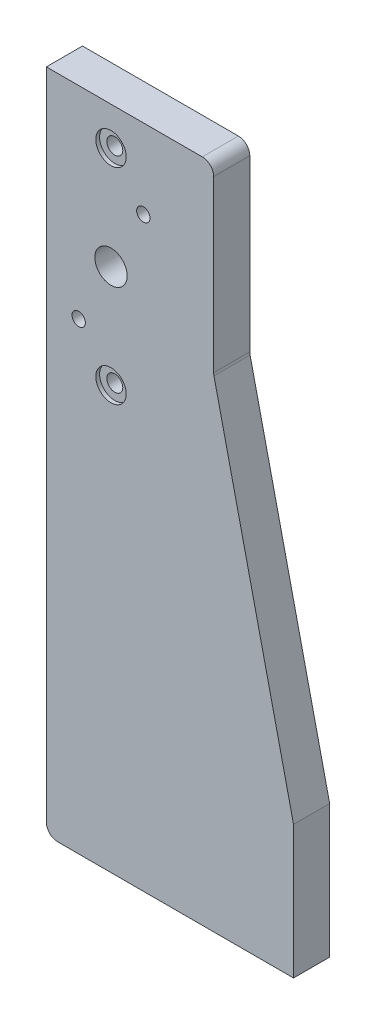
from build123d import *

# Parameters (mm, degrees)
EXTRUDE_1_DEPTH     = 9.5
SKETCH_6_R          = 2.1
CUT_EXTRUDE_5_DEPTH = 187.923112536
SKETCH_7_R          = 4
CUT_EXTRUDE_6_DEPTH = 1
FILLET_1_R          = 3
SKETCH_8_R          = 4.25
CUT_EXTRUDE_7_DEPTH = 10
SKETCH_9_R          = 1.75
CUT_EXTRUDE_8_DEPTH = 187.923112536


with BuildPart() as part:
    # 草图5 → 凸台-拉伸1 (new body)
    with BuildSketch(Plane.XY):
        Polygon((0, 0), (0, 175), (44, 175), (44, 127), (65, 35), (65, 0), align=None)
    extrude(amount=EXTRUDE_1_DEPTH)

    # 草图6 → 切除-拉伸5 (cut, through all)
    with BuildSketch(Plane.XY.offset(9.5)):
        with Locations((17, 165)):
            Circle(SKETCH_6_R)
        with Locations((17, 111)):
            Circle(SKETCH_6_R)
    extrude(amount=-CUT_EXTRUDE_5_DEPTH, mode=Mode.SUBTRACT)

    # 草图7 → 切除-拉伸6 (cut)
    with BuildSketch(Plane.XY.offset(9.5)):
        with Locations((17, 165)):
            Circle(SKETCH_7_R)
        with Locations((17, 111)):
            Circle(SKETCH_7_R)
    extrude(amount=-CUT_EXTRUDE_6_DEPTH, mode=Mode.SUBTRACT)

    # 圆角1
    fillet_1_edges = [part.edges().sort_by_distance(p)[0] for p in [
        (0, 0, 4.75),
        (44, 127, 4.75),
        (44, 175, 4.75),
    ]]
    fillet(fillet_1_edges, radius=FILLET_1_R)

    # 草图8 → 切除-拉伸7 (cut)
    with BuildSketch(Plane.XY.offset(9.5)):
        with Locations((17, 138)):
            Circle(SKETCH_8_R)
    extrude(amount=-CUT_EXTRUDE_7_DEPTH, mode=Mode.SUBTRACT)

    # 草图9 → 切除-拉伸8 (cut, through all)
    with BuildSketch(Plane(origin=(0, 0, 0), x_dir=(-1, 0, 0), z_dir=(0, 0, -1))):
        with Locations((-25.5, 154.1496904)):
            Circle(SKETCH_9_R)
        with Locations((-8.5, 121.8503096)):
            Circle(SKETCH_9_R)
    extrude(amount=-CUT_EXTRUDE_8_DEPTH, mode=Mode.SUBTRACT)


solid = part.part
